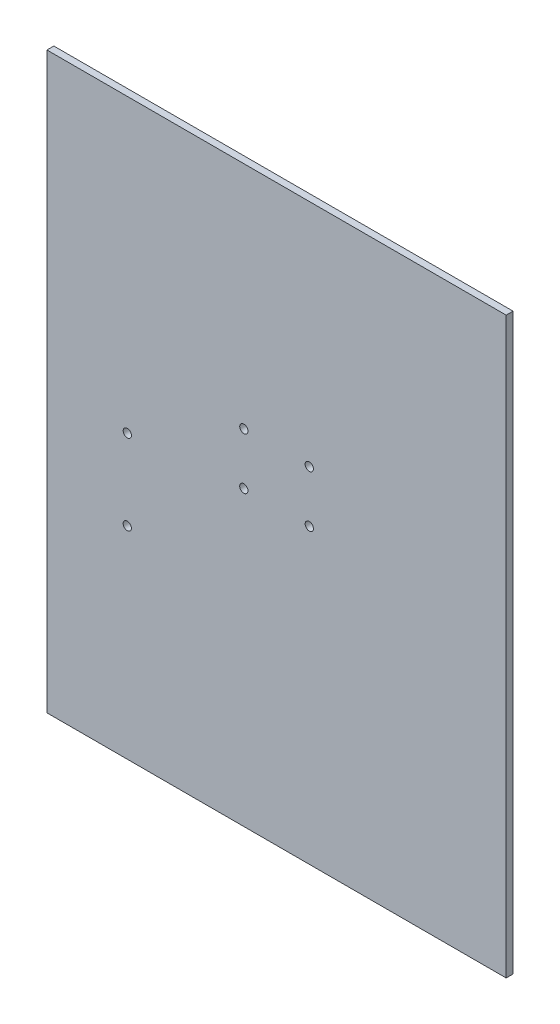
from build123d import *

# Parameters (mm, degrees)
ESBO_O1_W                = 200
ESBO_O1_H                = 250
ESBO_O1_R                = 1.8
RESSALTO_EXTRUS_O1_DEPTH = 3


with BuildPart() as part:
    # Esboço1 → Ressalto-extrusão1 (new body)
    with BuildSketch(Plane.XY):
        Rectangle(ESBO_O1_W, ESBO_O1_H)
        with Locations((-14.25, 25)):
            Circle(ESBO_O1_R, mode=Mode.SUBTRACT)
        with Locations((14.25, 25)):
            Circle(ESBO_O1_R, mode=Mode.SUBTRACT)
        with Locations((14.25, 2.5)):
            Circle(ESBO_O1_R, mode=Mode.SUBTRACT)
        with Locations((-14.25, 2.5)):
            Circle(ESBO_O1_R, mode=Mode.SUBTRACT)
        with Locations((-65, -2)):
            Circle(ESBO_O1_R, mode=Mode.SUBTRACT)
        with Locations((-65, -37)):
            Circle(ESBO_O1_R, mode=Mode.SUBTRACT)
    extrude(amount=RESSALTO_EXTRUS_O1_DEPTH)


solid = part.part
